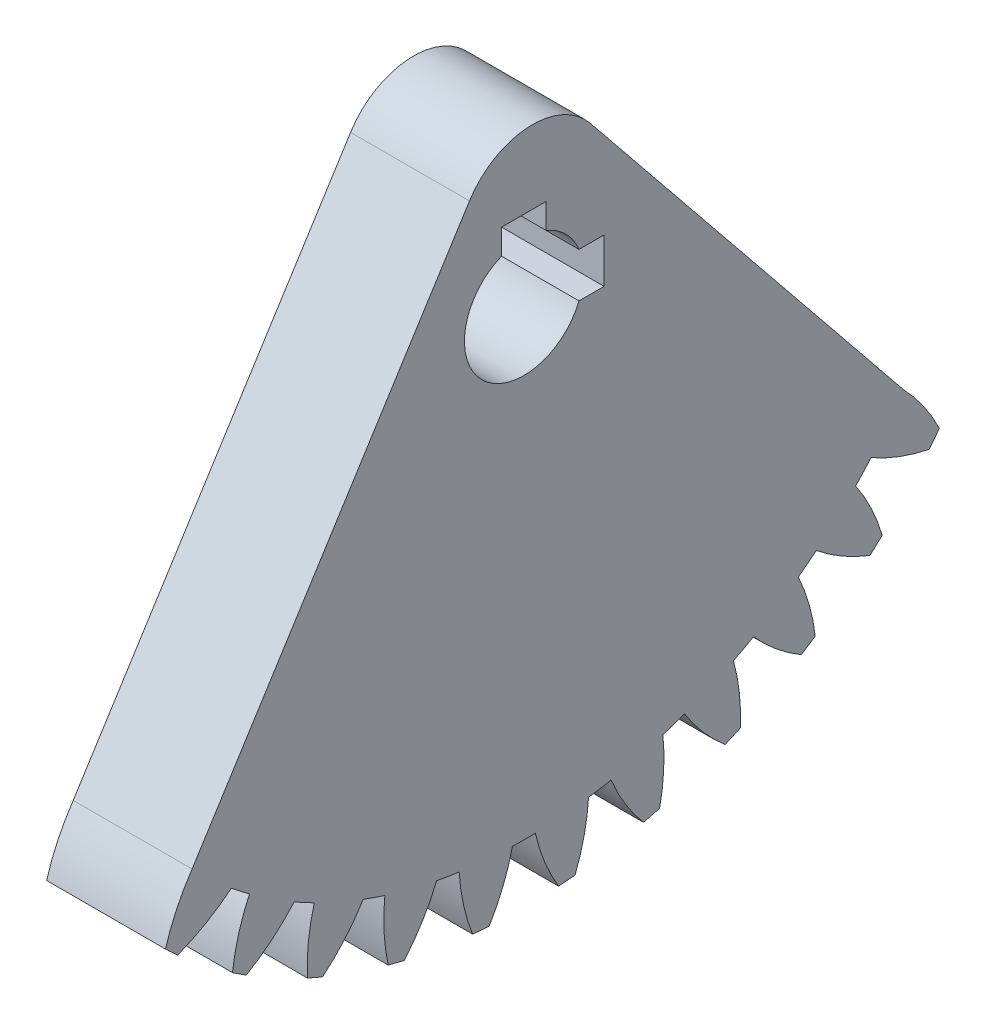
from build123d import *

# Parameters (mm, degrees)
SPUR_START          = -1.255872891
SPUR_GEAR_ISO_DEPTH = 8
CUT_EXTRUDE1_START  = -8
CUT_EXTRUDE1_DEPTH  = 8
FILLET1_R           = 5


# Read off the part's stored shape, not the designer's step: spur gear_iso
with BuildPart() as part:
    # spur gear_iso outline → spur gear_iso (new body)
    with BuildSketch(Plane.YZ.offset(SPUR_START)):
        with BuildLine():
            ThreePointArc((10.70226618, 30.878475903), (10.142251627, 30.882956422), (9.582237074, 30.878475903))
            ThreePointArc((9.582237074, 30.878475903), (8.805580488, 28.934301135), (8.343630809, 26.892337993))
            ThreePointArc((8.343630809, 26.892337993), (7.577213288, 26.838365652), (6.812365147, 26.765453703))
            ThreePointArc((6.812365147, 26.765453703), (6.020619773, 28.703532711), (4.934555121, 30.493357996))
            ThreePointArc((4.934555121, 30.493357996), (4.381440967, 30.405602041), (3.829801752, 30.309007264))
            ThreePointArc((3.829801752, 30.309007264), (3.383738399, 28.263515034), (3.264185198, 26.17336719))
            ThreePointArc((3.264185198, 26.17336719), (2.517104168, 25.993982783), (1.774688472, 25.796175391))
            ThreePointArc((1.774688472, 25.796175391), (0.674744152, 27.577504522), (-0.691103553, 29.164158557))
            ThreePointArc((-0.691103553, 29.164158557), (-1.222229795, 28.986559882), (-1.750446392, 28.800485701))
            ThreePointArc((-1.750446392, 28.800485701), (-1.853749067, 26.709471704), (-1.62764469, 24.628152942))
            ThreePointArc((-1.62764469, 24.628152942), (-2.335010805, 24.328249608), (-3.034742893, 24.010942444))
            ThreePointArc((-3.034742893, 24.010942444), (-4.412882545, 25.586931683), (-6.021256538, 26.927134682))
            ThreePointArc((-6.021256538, 26.927134682), (-6.515907129, 26.664537715), (-7.006292737, 26.394059749))
            ThreePointArc((-7.006292737, 26.394059749), (-6.764016906, 24.314561396), (-6.198422489, 22.298844666))
            ThreePointArc((-6.198422489, 22.298844666), (-6.846778586, 21.886602987), (-7.484740198, 21.458451363))
            ThreePointArc((-7.484740198, 21.458451363), (-9.103483124, 22.786111831), (-10.910511155, 23.843306549))
            ThreePointArc((-10.910511155, 23.843306549), (-11.355193317, 23.502874251), (-11.794371494, 23.155370434))
            ThreePointArc((-11.794371494, 23.155370434), (-11.21312581, 21.144111019), (-10.323469295, 19.24897982))
            ThreePointArc((-10.323469295, 19.24897982), (-10.89512991, 18.735644674), (-11.453919115, 18.20832745))
            ThreePointArc((-11.453919115, 18.20832745), (-13.269110228, 19.251444031), (-15.225501284, 19.996792953))
            ThreePointArc((-15.225501284, 19.996792953), (-15.608085246, 19.587811429), (-15.984076358, 19.172760759))
            ThreePointArc((-15.984076358, 19.172760759), (-15.079715688, 17.284602196), (-13.890264584, 15.561750766))
            ThreePointArc((-13.890264584, 15.561750766), (-14.369636305, 14.961324598), (-14.834010792, 14.349225613))
            ThreePointArc((-14.834010792, 14.349225613), (-16.796136411, 15.079344806), (-18.848525243, 15.492516756))
            ThreePointArc((-18.848525243, 15.492516756), (-19.158575112, 15.026141957), (-19.461123099, 14.554865934))
            ThreePointArc((-19.461123099, 14.554865934), (-18.258316045, 12.841312267), (-16.801515479, 11.337735501))
            ThreePointArc((-16.801515479, 11.337735501), (-17.175522296, 10.666596371), (-17.532815138, 9.98641209))
            ThreePointArc((-17.532815138, 9.98641209), (-19.58835359, 10.383618147), (-21.680756382, 10.453342871))
            ThreePointArc((-21.680756382, 10.453342871), (-21.909814806, 9.942296285), (-22.130666949, 9.427650091))
            ThreePointArc((-22.130666949, 9.427650091), (-20.662222952, 7.935442597), (-18.977810645, 6.692154151))
            ThreePointArc((-18.977810645, 6.692154151), (-19.236250626, 5.968608985), (-19.476715807, 5.238893062))
            ThreePointArc((-19.476715807, 5.238893062), (-21.569597361, 5.292351237), (-23.644938818, 5.016726826))
            ThreePointArc((-23.644938818, 5.016726826), (-23.786757681, 4.474948472), (-23.919889709, 3.930970313))
            ThreePointArc((-23.919889709, 3.930970313), (-22.225864093, 2.700812522), (-20.359786422, 1.751726064))
            ThreePointArc((-20.359786422, 1.751726064), (-20.495609998, 0.995511288), (-20.612688254, 0.236168472))
            ThreePointArc((-20.612688254, 0.236168472), (-22.685824559, -0.055579435), (-24.687494776, -0.669034665))
            ThreePointArc((-24.687494776, -0.669034665), (-24.738205628, -1.226766486), (-24.779986047, -1.785238304))
            ThreePointArc((-24.779986047, -1.785238304), (-22.906587414, -2.719790893), (-20.909746114, -3.34878676))
            ThreePointArc((-20.909746114, -3.34878676), (-20.919248373, -4.117043577), (-20.909746114, -4.885300395))
            ThreePointArc((-20.909746114, -4.885300395), (-22.906587414, -5.514296262), (-24.779986047, -6.448848851))
            ThreePointArc((-24.779986047, -6.448848851), (-24.738205628, -7.007320669), (-24.687494776, -7.56505249))
            ThreePointArc((-24.687494776, -7.56505249), (-22.685824559, -8.17850772), (-20.612688254, -8.470255627))
            ThreePointArc((-20.612688254, -8.470255627), (-20.495609998, -9.229598443), (-20.359786422, -9.985813219))
            ThreePointArc((-20.359786422, -9.985813219), (-22.225864092, -10.934899678), (-23.919889709, -12.165057468))
            ThreePointArc((-23.919889709, -12.165057468), (-23.786757681, -12.709035628), (-23.644938818, -13.250813982))
            ThreePointArc((-23.644938818, -13.250813982), (-21.569597361, -13.526438392), (-19.476715807, -13.472980218))
            ThreePointArc((-19.476715807, -13.472980218), (-19.236250626, -14.20269614), (-18.977810645, -14.926241306))
            ThreePointArc((-18.977810645, -14.926241306), (-20.662222952, -16.169529752), (-22.130666949, -17.661737246))
            ThreePointArc((-22.130666949, -17.661737246), (-21.909814806, -18.17638344), (-21.680756382, -18.687430026))
            ThreePointArc((-21.680756382, -18.687430026), (-19.58835359, -18.617705303), (-17.532815138, -18.220499246))
            ThreePointArc((-17.532815138, -18.220499246), (-17.175522296, -18.900683526), (-16.801515479, -19.571822656))
            ThreePointArc((-16.801515479, -19.571822656), (-18.258316045, -21.075399422), (-19.461123099, -22.788953089))
            ThreePointArc((-19.461123099, -22.788953089), (-19.158575112, -23.260229112), (-18.848525243, -23.726603911))
            ThreePointArc((-18.848525243, -23.726603911), (-16.79613641, -23.313431962), (-14.834010792, -22.583312768))
            ThreePointArc((-14.834010792, -22.583312768), (-14.369636305, -23.195411753), (-13.890264584, -23.795837921))
            ThreePointArc((-13.890264584, -23.795837921), (-15.079715688, -25.518689351), (-15.984076358, -27.406847914))
            ThreePointArc((-15.984076358, -27.406847914), (-15.608085247, -27.821898584), (-15.225501284, -28.230880108))
            ThreePointArc((-15.225501284, -28.230880108), (-13.269110228, -27.485531187), (-11.453919115, -26.442414605))
            ThreePointArc((-11.453919115, -26.442414605), (-10.89512991, -26.969731829), (-10.323469295, -27.483066975))
            ThreePointArc((-10.323469295, -27.483066975), (-11.21312581, -29.378198174), (-11.794371494, -31.389457589))
            ThreePointArc((-11.794371494, -31.389457589), (-11.355193317, -31.736961407), (-10.910511155, -32.077393705))
            ThreePointArc((-10.910511155, -32.077393705), (-9.103483124, -31.020198987), (-7.484740198, -29.692538518))
            ThreePointArc((-7.484740198, -29.692538518), (-6.846778586, -30.120690142), (-6.198422489, -30.532931821))
            ThreePointArc((-6.198422489, -30.532931821), (-6.764016906, -32.548648551), (-7.006292737, -34.628146904))
            ThreePointArc((-7.006292737, -34.628146904), (-6.515907129, -34.89862487), (-6.021256538, -35.161221837))
            ThreePointArc((-6.021256538, -35.161221837), (-4.412882545, -33.821018838), (-3.034742893, -32.2450296))
            ThreePointArc((-3.034742893, -32.2450296), (-2.335010806, -32.562336764), (-1.62764469, -32.862240097))
            ThreePointArc((-1.62764469, -32.862240097), (-1.853749067, -34.943558859), (-1.750446392, -37.034572856))
            ThreePointArc((-1.750446392, -37.034572856), (-1.222229795, -37.220647037), (-0.691103553, -37.398245713))
            ThreePointArc((-0.691103553, -37.398245713), (0.674744152, -35.811591678), (1.774688472, -34.030262547))
            ThreePointArc((1.774688472, -34.030262547), (2.517104168, -34.228069938), (3.264185198, -34.407454345))
            ThreePointArc((3.264185198, -34.407454345), (3.383738399, -36.49760219), (3.829801752, -38.54309442))
            ThreePointArc((3.829801752, -38.54309442), (4.381440967, -38.639689197), (4.934555121, -38.727445151))
            ThreePointArc((4.934555121, -38.727445151), (6.020619773, -36.937619866), (6.812365147, -34.999540858))
            ThreePointArc((6.812365147, -34.999540858), (7.577213288, -35.072452807), (8.343630809, -35.126425148))
            ThreePointArc((8.343630809, -35.126425148), (8.805580488, -37.16838829), (9.582237074, -39.112563058))
            ThreePointArc((9.582237074, -39.112563058), (10.142251627, -39.117043578), (10.70226618, -39.112563058))
            ThreePointArc((10.70226618, -39.112563058), (11.478922766, -37.16838829), (11.940872445, -35.126425148))
            ThreePointArc((11.940872445, -35.126425148), (12.707289966, -35.072452807), (13.472138107, -34.999540858))
            ThreePointArc((13.472138107, -34.999540858), (14.263883482, -36.937619866), (15.349948133, -38.727445151))
            ThreePointArc((15.349948133, -38.727445151), (15.903062287, -38.639689197), (16.454701502, -38.54309442))
            ThreePointArc((16.454701502, -38.54309442), (16.900764855, -36.49760219), (17.020318056, -34.407454345))
            ThreePointArc((17.020318056, -34.407454345), (17.767399086, -34.228069938), (18.509814783, -34.030262547))
            ThreePointArc((18.509814783, -34.030262547), (19.609759102, -35.811591678), (20.975606807, -37.398245713))
            ThreePointArc((20.975606807, -37.398245713), (21.506733049, -37.220647037), (22.034949647, -37.034572856))
            ThreePointArc((22.034949647, -37.034572856), (22.138252321, -34.943558859), (21.912147944, -32.862240097))
            ThreePointArc((21.912147944, -32.862240097), (22.61951406, -32.562336764), (23.319246148, -32.2450296))
            ThreePointArc((23.319246148, -32.2450296), (24.697385799, -33.821018838), (26.305759792, -35.161221837))
            ThreePointArc((26.305759792, -35.161221837), (26.800410383, -34.89862487), (27.290795991, -34.628146904))
            ThreePointArc((27.290795991, -34.628146904), (27.04852016, -32.548648551), (26.482925743, -30.532931821))
            ThreePointArc((26.482925743, -30.532931821), (27.131281841, -30.120690142), (27.769243452, -29.692538518))
            ThreePointArc((27.769243452, -29.692538518), (29.387986378, -31.020198987), (31.19501441, -32.077393705))
            ThreePointArc((31.19501441, -32.077393705), (31.639696572, -31.736961407), (32.078874749, -31.389457589))
            ThreePointArc((32.078874749, -31.389457589), (31.497629065, -29.378198174), (30.607972549, -27.483066975))
            ThreePointArc((30.607972549, -27.483066975), (31.179633164, -26.969731829), (31.73842237, -26.442414605))
            ThreePointArc((31.73842237, -26.442414605), (33.553613483, -27.485531187), (35.510004539, -28.230880108))
            ThreePointArc((35.510004539, -28.230880108), (35.892588501, -27.821898585), (36.268579612, -27.406847914))
            ThreePointArc((36.268579612, -27.406847914), (35.364218942, -25.518689351), (34.174767838, -23.795837921))
            ThreePointArc((34.174767838, -23.795837921), (34.65413956, -23.195411753), (35.118514046, -22.583312768))
            ThreePointArc((35.118514046, -22.583312768), (37.080639664, -23.313431962), (39.133028497, -23.726603911))
            ThreePointArc((39.133028497, -23.726603911), (39.443078366, -23.260229112), (39.745626354, -22.788953089))
            ThreePointArc((39.745626354, -22.788953089), (38.5428193, -21.075399422), (37.086018733, -19.571822656))
            ThreePointArc((37.086018733, -19.571822656), (37.46002555, -18.900683526), (37.817318393, -18.220499246))
            ThreePointArc((37.817318393, -18.220499246), (39.872856845, -18.617705303), (41.965259636, -18.687430026))
            ThreePointArc((41.965259636, -18.687430026), (42.19431806, -18.17638344), (42.415170203, -17.661737246))
            ThreePointArc((42.415170203, -17.661737246), (40.946726206, -16.169529752), (39.262313899, -14.926241306))
            ThreePointArc((39.262313899, -14.926241306), (39.52075388, -14.20269614), (39.761219061, -13.472980218))
            ThreePointArc((39.761219061, -13.472980218), (41.854100616, -13.526438392), (43.929442073, -13.250813982))
            ThreePointArc((43.929442073, -13.250813982), (44.071260935, -12.709035628), (44.204392963, -12.165057468))
            ThreePointArc((44.204392963, -12.165057468), (42.510367346, -10.934899678), (40.644289676, -9.985813219))
            ThreePointArc((40.644289676, -9.985813219), (40.780113253, -9.229598444), (40.897191508, -8.470255627))
            ThreePointArc((40.897191508, -8.470255627), (42.970327813, -8.17850772), (44.971998031, -7.56505249))
            ThreePointArc((44.971998031, -7.56505249), (45.022708882, -7.007320669), (45.064489301, -6.448848851))
            ThreePointArc((45.064489301, -6.448848851), (43.191090668, -5.514296262), (41.194249368, -4.885300395))
            ThreePointArc((41.194249368, -4.885300395), (41.203751627, -4.117043577), (41.194249368, -3.34878676))
            ThreePointArc((41.194249368, -3.34878676), (43.191090668, -2.719790893), (45.064489301, -1.785238304))
            ThreePointArc((45.064489301, -1.785238304), (45.022708882, -1.226766486), (44.971998031, -0.669034665))
            ThreePointArc((44.971998031, -0.669034665), (42.970327813, -0.055579435), (40.897191508, 0.236168472))
            ThreePointArc((40.897191508, 0.236168472), (40.780113253, 0.995511288), (40.644289676, 1.751726064))
            ThreePointArc((40.644289676, 1.751726064), (42.510367347, 2.700812522), (44.204392963, 3.930970313))
            ThreePointArc((44.204392963, 3.930970313), (44.071260935, 4.474948472), (43.929442073, 5.016726826))
            ThreePointArc((43.929442073, 5.016726826), (41.854100616, 5.292351237), (39.761219061, 5.238893062))
            ThreePointArc((39.761219061, 5.238893062), (39.52075388, 5.968608985), (39.262313899, 6.692154151))
            ThreePointArc((39.262313899, 6.692154151), (40.946726206, 7.935442597), (42.415170203, 9.427650091))
            ThreePointArc((42.415170203, 9.427650091), (42.19431806, 9.942296285), (41.965259636, 10.453342871))
            ThreePointArc((41.965259636, 10.453342871), (39.872856845, 10.383618147), (37.817318393, 9.98641209))
            ThreePointArc((37.817318393, 9.98641209), (37.46002555, 10.666596371), (37.086018733, 11.337735501))
            ThreePointArc((37.086018733, 11.337735501), (38.5428193, 12.841312267), (39.745626354, 14.554865934))
            ThreePointArc((39.745626354, 14.554865934), (39.443078366, 15.026141957), (39.133028497, 15.492516756))
            ThreePointArc((39.133028497, 15.492516756), (37.080639665, 15.079344806), (35.118514046, 14.349225613))
            ThreePointArc((35.118514046, 14.349225613), (34.65413956, 14.961324598), (34.174767838, 15.561750766))
            ThreePointArc((34.174767838, 15.561750766), (35.364218942, 17.284602196), (36.268579612, 19.172760759))
            ThreePointArc((36.268579612, 19.172760759), (35.892588501, 19.587811429), (35.510004539, 19.996792953))
            ThreePointArc((35.510004539, 19.996792953), (33.553613483, 19.251444031), (31.73842237, 18.20832745))
            ThreePointArc((31.73842237, 18.20832745), (31.179633164, 18.735644674), (30.607972549, 19.24897982))
            ThreePointArc((30.607972549, 19.24897982), (31.497629065, 21.144111019), (32.078874749, 23.155370434))
            ThreePointArc((32.078874749, 23.155370434), (31.639696571, 23.502874251), (31.19501441, 23.843306549))
            ThreePointArc((31.19501441, 23.843306549), (29.387986378, 22.786111831), (27.769243452, 21.458451363))
            ThreePointArc((27.769243452, 21.458451363), (27.131281841, 21.886602987), (26.482925743, 22.298844666))
            ThreePointArc((26.482925743, 22.298844666), (27.04852016, 24.314561396), (27.290795991, 26.394059749))
            ThreePointArc((27.290795991, 26.394059749), (26.800410383, 26.664537715), (26.305759792, 26.927134682))
            ThreePointArc((26.305759792, 26.927134682), (24.697385799, 25.586931683), (23.319246148, 24.010942444))
            ThreePointArc((23.319246148, 24.010942444), (22.61951406, 24.328249608), (21.912147944, 24.628152942))
            ThreePointArc((21.912147944, 24.628152942), (22.138252321, 26.709471704), (22.034949647, 28.800485701))
            ThreePointArc((22.034949647, 28.800485701), (21.506733049, 28.986559882), (20.975606807, 29.164158557))
            ThreePointArc((20.975606807, 29.164158557), (19.609759102, 27.577504522), (18.509814783, 25.796175391))
            ThreePointArc((18.509814783, 25.796175391), (17.767399086, 25.993982783), (17.020318056, 26.17336719))
            ThreePointArc((17.020318056, 26.17336719), (16.900764855, 28.263515034), (16.454701502, 30.309007264))
            ThreePointArc((16.454701502, 30.309007264), (15.903062287, 30.405602041), (15.349948133, 30.493357996))
            ThreePointArc((15.349948133, 30.493357996), (14.263883482, 28.703532711), (13.472138107, 26.765453703))
            ThreePointArc((13.472138107, 26.765453703), (12.707289966, 26.838365652), (11.940872445, 26.892337993))
            ThreePointArc((11.940872445, 26.892337993), (11.478922766, 28.934301135), (10.70226618, 30.878475903))
        make_face()
        with BuildLine():
            Line((8.642251627, -9.517043578), (8.642251627, -7.825142821))
            ThreePointArc((8.642251627, -7.825142821), (7.313824503, -1.288616452), (13.850350871, -2.617043578))
            Line((13.850350871, -2.617043578), (15.542251627, -2.617043578))
            Line((15.542251627, -2.617043578), (15.542251627, -5.617043578))
            Line((15.542251627, -5.617043578), (13.850350871, -5.617043578))
            ThreePointArc((13.850350871, -5.617043578), (12.970678752, -6.945470702), (11.642251627, -7.825142821))
            Line((11.642251627, -7.825142821), (11.642251627, -9.517043578))
            Line((11.642251627, -9.517043578), (8.642251627, -9.517043578))
        make_face(mode=Mode.SUBTRACT)
    extrude(amount=SPUR_GEAR_ISO_DEPTH)

    # Sketch1 → Cut-Extrude1 (cut)
    with BuildSketch(Plane(origin=(6.744127109, 0, 0), x_dir=(0, 0, -1), z_dir=(1, 0, 0)).offset(CUT_EXTRUDE1_START)):
        with BuildLine():
            ThreePointArc((-19.24897982, -10.323469295), (-18.735644674, -10.89512991), (-18.20832745, -11.453919115))
            Line((-18.20832745, -11.453919115), (4.181405833, 24.055987178))
            Line((4.181405833, 24.055987178), (29.692538518, -7.484740198))
            ThreePointArc((29.692538518, -7.484740198), (30.120690142, -6.846778586), (30.532931821, -6.198422489))
            ThreePointArc((30.532931821, -6.198422489), (32.548648551, -6.764016906), (34.628146904, -7.006292737))
            ThreePointArc((34.628146904, -7.006292737), (34.89862487, -6.515907129), (35.161221837, -6.021256538))
            ThreePointArc((35.161221837, -6.021256538), (33.821018838, -4.412882545), (32.2450296, -3.034742893))
            ThreePointArc((32.2450296, -3.034742893), (32.562336764, -2.335010806), (32.862240097, -1.62764469))
            ThreePointArc((32.862240097, -1.62764469), (34.943558859, -1.853749067), (37.034572856, -1.750446392))
            ThreePointArc((37.034572856, -1.750446392), (37.220647037, -1.222229795), (37.398245713, -0.691103553))
            ThreePointArc((37.398245713, -0.691103553), (35.811591678, 0.674744152), (34.030262547, 1.774688472))
            ThreePointArc((34.030262547, 1.774688472), (34.228069938, 2.517104168), (34.407454345, 3.264185198))
            ThreePointArc((34.407454345, 3.264185198), (36.49760219, 3.383738399), (38.54309442, 3.829801752))
            ThreePointArc((38.54309442, 3.829801752), (38.639689197, 4.381440967), (38.727445151, 4.934555121))
            ThreePointArc((38.727445151, 4.934555121), (36.937619866, 6.020619773), (34.999540858, 6.812365147))
            ThreePointArc((34.999540858, 6.812365147), (35.072452807, 7.577213288), (35.126425148, 8.343630809))
            ThreePointArc((35.126425148, 8.343630809), (37.16838829, 8.805580488), (39.112563058, 9.582237074))
            ThreePointArc((39.112563058, 9.582237074), (39.117043578, 10.142251627), (39.112563058, 10.70226618))
            ThreePointArc((39.112563058, 10.70226618), (37.16838829, 11.478922766), (35.126425148, 11.940872445))
            ThreePointArc((35.126425148, 11.940872445), (35.072452807, 12.707289966), (34.999540858, 13.472138107))
            ThreePointArc((34.999540858, 13.472138107), (36.937619866, 14.263883482), (38.727445151, 15.349948133))
            ThreePointArc((38.727445151, 15.349948133), (38.639689197, 15.903062287), (38.54309442, 16.454701502))
            ThreePointArc((38.54309442, 16.454701502), (36.49760219, 16.900764855), (34.407454345, 17.020318056))
            ThreePointArc((34.407454345, 17.020318056), (34.228069938, 17.767399086), (34.030262547, 18.509814783))
            ThreePointArc((34.030262547, 18.509814783), (35.811591678, 19.609759102), (37.398245713, 20.975606807))
            ThreePointArc((37.398245713, 20.975606807), (37.220647037, 21.506733049), (37.034572856, 22.034949647))
            ThreePointArc((37.034572856, 22.034949647), (34.943558859, 22.138252321), (32.862240097, 21.912147944))
            ThreePointArc((32.862240097, 21.912147944), (32.562336764, 22.61951406), (32.2450296, 23.319246148))
            ThreePointArc((32.2450296, 23.319246148), (33.821018838, 24.697385799), (35.161221837, 26.305759792))
            ThreePointArc((35.161221837, 26.305759792), (34.89862487, 26.800410383), (34.628146904, 27.290795991))
            ThreePointArc((34.628146904, 27.290795991), (32.548648551, 27.04852016), (30.532931821, 26.482925743))
            ThreePointArc((30.532931821, 26.482925743), (30.120690142, 27.131281841), (29.692538518, 27.769243452))
            ThreePointArc((29.692538518, 27.769243452), (31.020198987, 29.387986378), (32.077393705, 31.19501441))
            ThreePointArc((32.077393705, 31.19501441), (31.736961407, 31.639696572), (31.389457589, 32.078874749))
            ThreePointArc((31.389457589, 32.078874749), (29.378198174, 31.497629065), (27.483066975, 30.607972549))
            ThreePointArc((27.483066975, 30.607972549), (26.969731829, 31.179633164), (26.442414605, 31.73842237))
            ThreePointArc((26.442414605, 31.73842237), (27.485531187, 33.553613483), (28.230880108, 35.510004539))
            ThreePointArc((28.230880108, 35.510004539), (27.821898585, 35.892588501), (27.406847914, 36.268579612))
            ThreePointArc((27.406847914, 36.268579612), (25.518689351, 35.364218942), (23.795837921, 34.174767838))
            ThreePointArc((23.795837921, 34.174767838), (23.195411753, 34.65413956), (22.583312768, 35.118514046))
            ThreePointArc((22.583312768, 35.118514046), (23.313431962, 37.080639664), (23.726603911, 39.133028497))
            ThreePointArc((23.726603911, 39.133028497), (23.260229112, 39.443078366), (22.788953089, 39.745626354))
            ThreePointArc((22.788953089, 39.745626354), (21.075399422, 38.5428193), (19.571822656, 37.086018733))
            ThreePointArc((19.571822656, 37.086018733), (18.900683526, 37.46002555), (18.220499246, 37.817318393))
            ThreePointArc((18.220499246, 37.817318393), (18.617705303, 39.872856845), (18.687430026, 41.965259636))
            ThreePointArc((18.687430026, 41.965259636), (18.17638344, 42.19431806), (17.661737246, 42.415170203))
            ThreePointArc((17.661737246, 42.415170203), (16.169529752, 40.946726206), (14.926241306, 39.262313899))
            ThreePointArc((14.926241306, 39.262313899), (14.20269614, 39.52075388), (13.472980218, 39.761219061))
            ThreePointArc((13.472980218, 39.761219061), (13.526438392, 41.854100616), (13.250813982, 43.929442073))
            ThreePointArc((13.250813982, 43.929442073), (12.709035628, 44.071260935), (12.165057468, 44.204392963))
            ThreePointArc((12.165057468, 44.204392963), (10.934899678, 42.510367346), (9.985813219, 40.644289676))
            ThreePointArc((9.985813219, 40.644289676), (9.229598444, 40.780113253), (8.470255627, 40.897191508))
            ThreePointArc((8.470255627, 40.897191508), (8.17850772, 42.970327813), (7.56505249, 44.971998031))
            ThreePointArc((7.56505249, 44.971998031), (7.007320669, 45.022708882), (6.448848851, 45.064489301))
            ThreePointArc((6.448848851, 45.064489301), (5.514296262, 43.191090668), (4.885300395, 41.194249368))
            ThreePointArc((4.885300395, 41.194249368), (4.117043577, 41.203751627), (3.34878676, 41.194249368))
            ThreePointArc((3.34878676, 41.194249368), (2.719790893, 43.191090668), (1.785238304, 45.064489301))
            ThreePointArc((1.785238304, 45.064489301), (1.226766486, 45.022708882), (0.669034665, 44.971998031))
            ThreePointArc((0.669034665, 44.971998031), (0.055579435, 42.970327813), (-0.236168472, 40.897191508))
            ThreePointArc((-0.236168472, 40.897191508), (-0.995511288, 40.780113253), (-1.751726064, 40.644289676))
            ThreePointArc((-1.751726064, 40.644289676), (-2.700812522, 42.510367347), (-3.930970313, 44.204392963))
            ThreePointArc((-3.930970313, 44.204392963), (-4.474948472, 44.071260935), (-5.016726826, 43.929442073))
            ThreePointArc((-5.016726826, 43.929442073), (-5.292351237, 41.854100616), (-5.238893062, 39.761219061))
            ThreePointArc((-5.238893062, 39.761219061), (-5.968608985, 39.52075388), (-6.692154151, 39.262313899))
            ThreePointArc((-6.692154151, 39.262313899), (-7.935442597, 40.946726206), (-9.427650091, 42.415170203))
            ThreePointArc((-9.427650091, 42.415170203), (-9.942296285, 42.19431806), (-10.453342871, 41.965259636))
            ThreePointArc((-10.453342871, 41.965259636), (-10.383618147, 39.872856845), (-9.98641209, 37.817318393))
            ThreePointArc((-9.98641209, 37.817318393), (-10.666596371, 37.46002555), (-11.337735501, 37.086018733))
            ThreePointArc((-11.337735501, 37.086018733), (-12.841312267, 38.5428193), (-14.554865934, 39.745626354))
            ThreePointArc((-14.554865934, 39.745626354), (-15.026141957, 39.443078366), (-15.492516756, 39.133028497))
            ThreePointArc((-15.492516756, 39.133028497), (-15.079344806, 37.080639665), (-14.349225613, 35.118514046))
            ThreePointArc((-14.349225613, 35.118514046), (-14.961324598, 34.65413956), (-15.561750766, 34.174767838))
            ThreePointArc((-15.561750766, 34.174767838), (-17.284602196, 35.364218942), (-19.172760759, 36.268579612))
            ThreePointArc((-19.172760759, 36.268579612), (-19.587811429, 35.892588501), (-19.996792953, 35.510004539))
            ThreePointArc((-19.996792953, 35.510004539), (-19.251444031, 33.553613483), (-18.20832745, 31.73842237))
            ThreePointArc((-18.20832745, 31.73842237), (-18.735644674, 31.179633164), (-19.24897982, 30.607972549))
            ThreePointArc((-19.24897982, 30.607972549), (-21.144111019, 31.497629065), (-23.155370434, 32.078874749))
            ThreePointArc((-23.155370434, 32.078874749), (-23.502874251, 31.639696571), (-23.843306549, 31.19501441))
            ThreePointArc((-23.843306549, 31.19501441), (-22.786111831, 29.387986378), (-21.458451363, 27.769243452))
            ThreePointArc((-21.458451363, 27.769243452), (-21.886602987, 27.131281841), (-22.298844666, 26.482925743))
            ThreePointArc((-22.298844666, 26.482925743), (-24.314561396, 27.04852016), (-26.394059749, 27.290795991))
            ThreePointArc((-26.394059749, 27.290795991), (-26.664537715, 26.800410383), (-26.927134682, 26.305759792))
            ThreePointArc((-26.927134682, 26.305759792), (-25.586931683, 24.697385799), (-24.010942444, 23.319246148))
            ThreePointArc((-24.010942444, 23.319246148), (-24.328249608, 22.61951406), (-24.628152942, 21.912147944))
            ThreePointArc((-24.628152942, 21.912147944), (-26.709471704, 22.138252321), (-28.800485701, 22.034949647))
            ThreePointArc((-28.800485701, 22.034949647), (-28.986559882, 21.506733049), (-29.164158557, 20.975606807))
            ThreePointArc((-29.164158557, 20.975606807), (-27.577504522, 19.609759102), (-25.796175391, 18.509814783))
            ThreePointArc((-25.796175391, 18.509814783), (-25.993982783, 17.767399086), (-26.17336719, 17.020318056))
            ThreePointArc((-26.17336719, 17.020318056), (-28.263515034, 16.900764855), (-30.309007264, 16.454701502))
            ThreePointArc((-30.309007264, 16.454701502), (-30.405602041, 15.903062287), (-30.493357996, 15.349948133))
            ThreePointArc((-30.493357996, 15.349948133), (-28.703532711, 14.263883482), (-26.765453703, 13.472138107))
            ThreePointArc((-26.765453703, 13.472138107), (-26.838365652, 12.707289966), (-26.892337993, 11.940872445))
            ThreePointArc((-26.892337993, 11.940872445), (-28.934301135, 11.478922766), (-30.878475903, 10.70226618))
            ThreePointArc((-30.878475903, 10.70226618), (-30.882956422, 10.142251627), (-30.878475903, 9.582237074))
            ThreePointArc((-30.878475903, 9.582237074), (-28.934301135, 8.805580488), (-26.892337993, 8.343630809))
            ThreePointArc((-26.892337993, 8.343630809), (-26.838365652, 7.577213288), (-26.765453703, 6.812365147))
            ThreePointArc((-26.765453703, 6.812365147), (-28.703532711, 6.020619773), (-30.493357996, 4.934555121))
            ThreePointArc((-30.493357996, 4.934555121), (-30.405602041, 4.381440967), (-30.309007264, 3.829801752))
            ThreePointArc((-30.309007264, 3.829801752), (-28.263515034, 3.383738399), (-26.17336719, 3.264185198))
            ThreePointArc((-26.17336719, 3.264185198), (-25.993982783, 2.517104168), (-25.796175391, 1.774688472))
            ThreePointArc((-25.796175391, 1.774688472), (-27.577504522, 0.674744152), (-29.164158557, -0.691103553))
            ThreePointArc((-29.164158557, -0.691103553), (-28.986559882, -1.222229795), (-28.800485701, -1.750446392))
            ThreePointArc((-28.800485701, -1.750446392), (-26.709471704, -1.853749067), (-24.628152942, -1.62764469))
            ThreePointArc((-24.628152942, -1.62764469), (-24.328249608, -2.335010805), (-24.010942444, -3.034742893))
            ThreePointArc((-24.010942444, -3.034742893), (-25.586931683, -4.412882545), (-26.927134682, -6.021256538))
            ThreePointArc((-26.927134682, -6.021256538), (-26.664537715, -6.515907129), (-26.394059749, -7.006292737))
            ThreePointArc((-26.394059749, -7.006292737), (-24.314561396, -6.764016906), (-22.298844666, -6.198422489))
            ThreePointArc((-22.298844666, -6.198422489), (-21.886602987, -6.846778586), (-21.458451363, -7.484740198))
            ThreePointArc((-21.458451363, -7.484740198), (-22.786111831, -9.103483124), (-23.843306549, -10.910511155))
            ThreePointArc((-23.843306549, -10.910511155), (-23.502874251, -11.355193317), (-23.155370434, -11.794371494))
            ThreePointArc((-23.155370434, -11.794371494), (-21.144111019, -11.21312581), (-19.24897982, -10.323469295))
        make_face()
    extrude(amount=CUT_EXTRUDE1_DEPTH, mode=Mode.SUBTRACT)

    # Fillet1
    fillet1_edges = [part.edges().sort_by_distance(p)[0] for p in [
        (2.744127109, 24.055987178, -4.181405833),
    ]]
    fillet(fillet1_edges, radius=FILLET1_R)


solid = part.part
